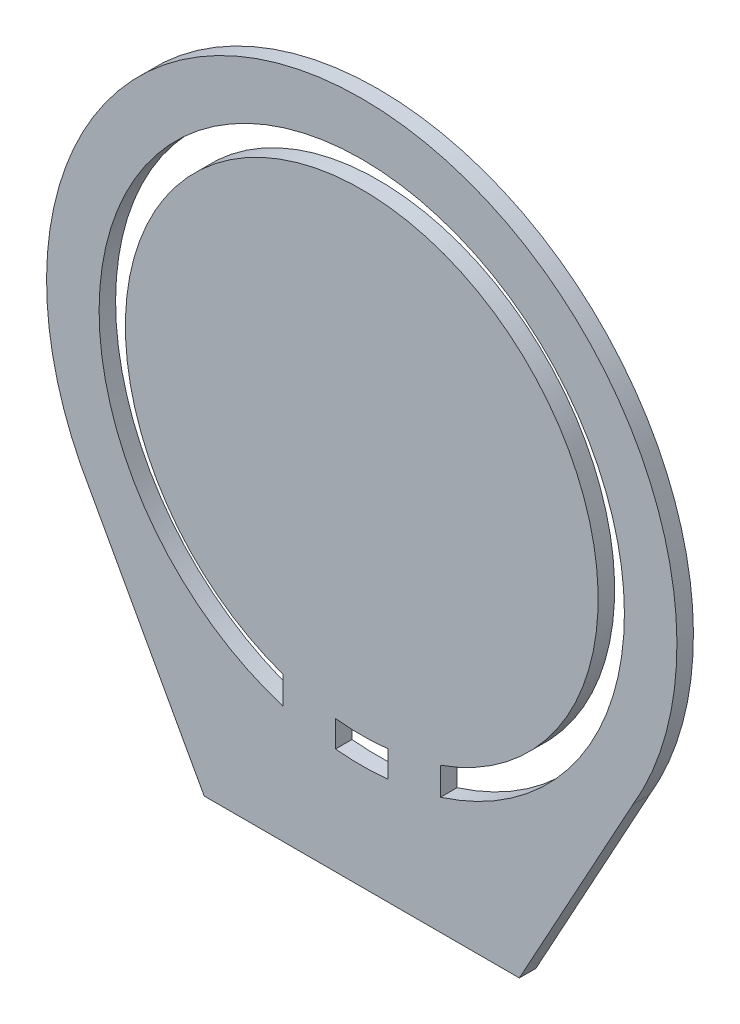
from build123d import *

# Parameters (mm, degrees)
ESBO_O1_R           = 30
ESBO_O1_R_2         = 25
BOSS_EXTRUDE1_DEPTH = 1.57
BOSS_EXTRUDE2_START = -1.57
BOSS_EXTRUDE2_DEPTH = 1.57
BOSS_EXTRUDE3_DEPTH = 1.57
BOSS_EXTRUDE4_START = -1.57
SKETCH4_R           = 22.5
BOSS_EXTRUDE4_DEPTH = 1.57


with BuildPart() as part:
    # Esboço1 → Boss-Extrude1 (new body)
    with BuildSketch(Plane.XY):
        Circle(ESBO_O1_R)
        Circle(ESBO_O1_R_2, mode=Mode.SUBTRACT)
    extrude(amount=BOSS_EXTRUDE1_DEPTH)

    # Sketch1 → Boss-Extrude2 (add)
    with BuildSketch(Plane.XY.offset(1.57).offset(BOSS_EXTRUDE2_START)):
        with BuildLine():
            ThreePointArc((25.800536663, -15.307916512), (0, -30), (-25.800536663, -15.307916512))
            Line((-25.800536663, -15.307916512), (-15, -35))
            Line((-15, -35), (15, -35))
            Line((15, -35), (25.800536663, -15.307916512))
        make_face()
    extrude(amount=BOSS_EXTRUDE2_DEPTH)

    # Sketch2 → Boss-Extrude3 (add)
    with BuildSketch(Plane.XY):
        with BuildLine():
            ThreePointArc((7.5, -21.213203436), (5.0328099, -21.929907079), (2.5, -22.360679775))
            Line((2.5, -22.360679775), (2.5, -25))
            Line((2.5, -25), (7.5, -25))
            Line((7.5, -25), (7.5, -21.213203436))
        make_face()
        with BuildLine():
            Line((-2.5, -25), (-2.5, -22.360679775))
            ThreePointArc((-2.5, -22.360679775), (-5.0328099, -21.929907079), (-7.5, -21.213203436))
            Line((-7.5, -21.213203436), (-7.5, -25))
            Line((-7.5, -25), (-2.5, -25))
        make_face()
    extrude(amount=BOSS_EXTRUDE3_DEPTH)

    # Sketch4 → Boss-Extrude4 (add)
    with BuildSketch(Plane.XY.offset(1.57).offset(BOSS_EXTRUDE4_START)):
        Circle(SKETCH4_R)
    extrude(amount=BOSS_EXTRUDE4_DEPTH)


solid = part.part
